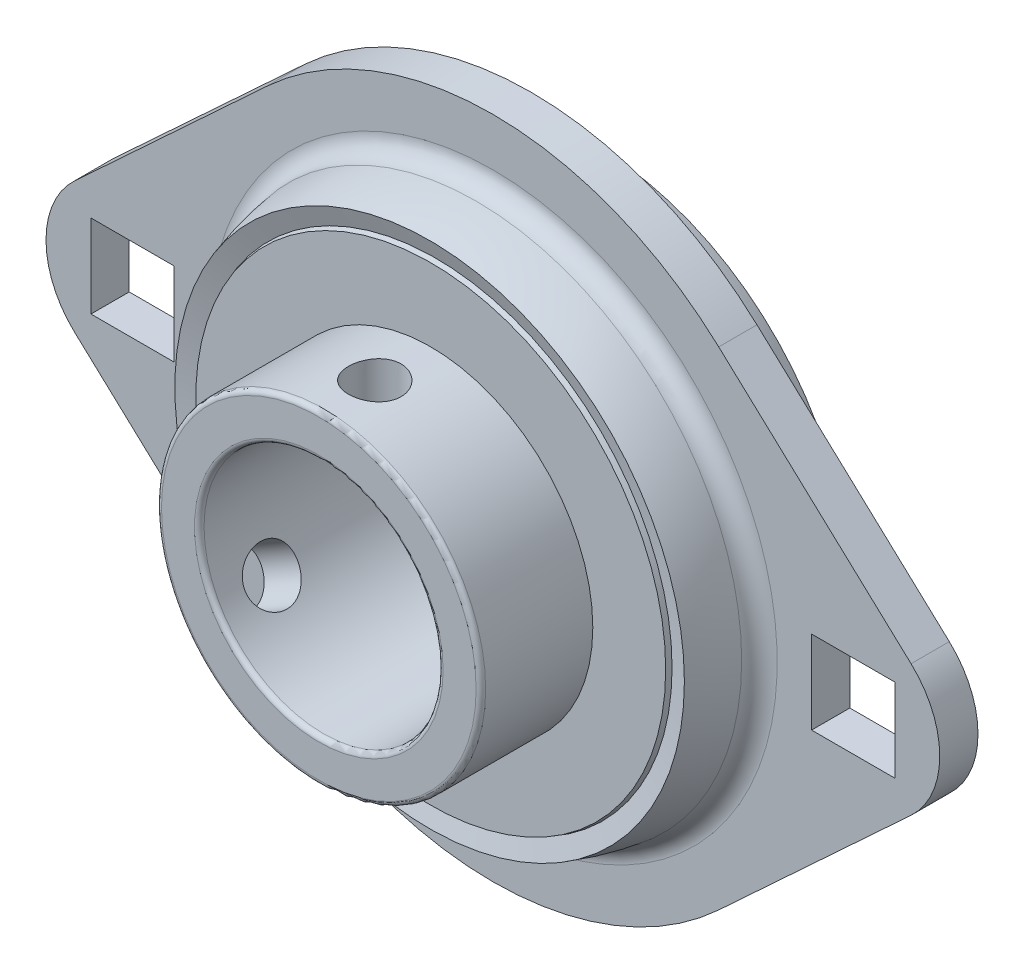
from build123d import *

# Parameters (mm, degrees)
SKETCH_2_W                   = 16.95
SKETCH_2_H                   = 5.5
SKETCH_3_W                   = 16.95
SKETCH_3_H                   = 11.7
HOLE_WIZARD_25_0_25_1_D      = 25
HOLE_WIZARD_5_5_5_5_1_REACH  = 62.391
HOLE_WIZARD_5_5_5_5_1_BORE_R = 2.75
HOLE_WIZARD_5_5_5_5_2_REACH  = 59.658
HOLE_WIZARD_5_5_5_5_2_BORE_R = 2.75
FILLET_1_R                   = 0.5
COMBINE_START                = -10.5
COMBINE_1_2_OUTLINE_W        = 8.7
COMBINE_1_2_OUTLINE_H        = 8.7
COMBINE_1_2_OUTLINE_R        = 29.732137495
COMBINE_1_2_DEPTH            = 4


with BuildPart() as part:
    # Эскиз1 → Повернуть1 (revolve)
    with BuildSketch(Plane(origin=(0, 0, 0), x_dir=(1, 0, 0), z_dir=(0, 1, 0))):
        with BuildLine():
            Line((24.571324751, 17), (0, 17))
            Line((0, 17), (0, 0))
            Line((0, 0), (24.571324751, 0))
            ThreePointArc((24.571324751, 0), (26, 8.5), (24.571324751, 17))
        make_face()
    revolve(axis=Axis((0, 0, -17), (0, 0, 1)))

    # Эскиз2 → Повернуть2 (revolve)
    with BuildSketch(Plane(origin=(0, 0, 0), x_dir=(1, 0, 0), z_dir=(0, 1, 0))):
        with Locations((8.475, 19.75)):
            Rectangle(SKETCH_2_W, SKETCH_2_H)
    revolve(axis=Axis((0, 0, -22.5), (0, 0, 1)))

    # Эскиз3 → Повернуть3 (revolve)
    with BuildSketch(Plane(origin=(0, 0, 0), x_dir=(1, 0, 0), z_dir=(0, 1, 0))):
        with Locations((8.475, -5.85)):
            Rectangle(SKETCH_3_W, SKETCH_3_H)
    revolve(axis=Axis((0, 0, 0), (0, 0, 1)))

    # Диаметр отверстия Ø25.0 (25)1 (through all)
    with Locations(Plane(origin=(0, 0, -22.5), x_dir=(-1, 0, 0), z_dir=(0, 0, -1))):
        with Locations((0, 0)):
            Hole(HOLE_WIZARD_25_0_25_1_D / 2)

    # Диаметр отверстия Ø5.5 (5.5)1 bore (on position points) → Диаметр отверстия Ø5.5 (5.5)1 (cut, up to next)
    with BuildSketch(Plane(origin=(-14.679130594, -8.475, 5.85), x_dir=(0.5, -0.866025403784, 0), z_dir=(-0.866025403784, -0.5, 0)), mode=Mode.PRIVATE) as hole_wizard_5_5_5_5_1_sk1:
        Circle(HOLE_WIZARD_5_5_5_5_1_BORE_R)
    hole_wizard_5_5_5_5_1_tool1 = extrude(hole_wizard_5_5_5_5_1_sk1.sketch, amount=-HOLE_WIZARD_5_5_5_5_1_REACH, mode=Mode.PRIVATE) & part.part
    add(hole_wizard_5_5_5_5_1_tool1.solids().sort_by_distance((-14.679131, -8.475, 5.85))[0], mode=Mode.SUBTRACT)

    # Диаметр отверстия Ø5.5 (5.5)2 bore (on position points) → Диаметр отверстия Ø5.5 (5.5)2 (cut, up to next)
    with BuildSketch(Plane(origin=(0, 16.95, 5.85), x_dir=(1, 0, 0), z_dir=(0, 1, 0)), mode=Mode.PRIVATE) as hole_wizard_5_5_5_5_2_sk1:
        Circle(HOLE_WIZARD_5_5_5_5_2_BORE_R)
    hole_wizard_5_5_5_5_2_tool1 = extrude(hole_wizard_5_5_5_5_2_sk1.sketch, amount=-HOLE_WIZARD_5_5_5_5_2_REACH, mode=Mode.PRIVATE) & part.part
    add(hole_wizard_5_5_5_5_2_tool1.solids().sort_by_distance((0, 16.95, 5.85))[0], mode=Mode.SUBTRACT)

    # Скругление1
    fillet_1_edges = [part.edges().sort_by_distance(p)[0] for p in [
        (-16.95, 0, 11.7),
        (-12.5, 0, -22.5),
        (-12.5, 0, 11.7),
        (-16.95, 0, -22.5),
    ]]
    fillet(fillet_1_edges, radius=FILLET_1_R)

    # Combine 1: read off the stored shape, not the designer's step
    # Combine 1 outline → Combine 1 (revolve)
    with BuildSketch(Plane.XZ):
        with BuildLine():
            ThreePointArc((29.732137495, -8.5), (27.09901514, -9.488909389), (25.767852495, -11.966666667))
            Line((25.767852495, -11.966666667), (24.738633754, -11.966666667))
            Line((24.738633754, -11.966666667), (24.738633754, -16.5))
            Line((24.738633754, -16.5), (26.641605576, -17.115384628))
            ThreePointArc((26.641605576, -17.115384628), (27.305130644, -14.699180633), (27.749994997, -12.23333332))
            ThreePointArc((27.749994997, -12.23333332), (28.415576323, -10.99445469), (29.732137495, -10.5))
            Line((29.732137495, -10.5), (29.732137495, -8.5))
        make_face()
        with BuildLine():
            ThreePointArc((25.767852495, -5.033333333), (27.09901514, -7.511090611), (29.732137495, -8.5))
            Line((29.732137495, -8.5), (29.732137495, -6.5))
            ThreePointArc((29.732137495, -6.5), (28.415576323, -6.00554531), (27.749994997, -4.766666681))
            ThreePointArc((27.749994997, -4.766666681), (27.305130644, -2.300819367), (26.641605576, 0.115384628))
            Line((26.641605576, 0.115384628), (24.738633754, -0.5))
            Line((24.738633754, -0.5), (24.738633754, -5.033333333))
            Line((24.738633754, -5.033333333), (25.767852495, -5.033333333))
        make_face()
    revolve(axis=Axis((0, 0, 0), (0, 0, 1)))

    # Combine 1 2 outline → Combine 1 2 (add)
    with BuildSketch(Plane.XY.offset(COMBINE_START)):
        with BuildLine():
            Line((-43.727741416, -6.862048778), (-23.614933424, -25.493085717))
            ThreePointArc((-23.614933424, -25.493085717), (0, -34.75), (23.614933424, -25.493085717))
            Line((23.614933424, -25.493085717), (43.727741416, -6.862048778))
            ThreePointArc((43.727741416, -6.862048778), (46.725, 0), (43.727741416, 6.862048778))
            Line((43.727741416, 6.862048778), (23.614933424, 25.493085717))
            ThreePointArc((23.614933424, 25.493085717), (0, 34.75), (-23.614933424, 25.493085717))
            Line((-23.614933424, 25.493085717), (-43.727741416, 6.862048778))
            ThreePointArc((-43.727741416, 6.862048778), (-46.725, 0), (-43.727741416, -6.862048778))
        make_face()
        with Locations((-37.675, 0)):
            Rectangle(COMBINE_1_2_OUTLINE_W, COMBINE_1_2_OUTLINE_H, mode=Mode.SUBTRACT)
        Circle(COMBINE_1_2_OUTLINE_R, mode=Mode.SUBTRACT)
        with Locations((37.675, 0)):
            Rectangle(COMBINE_1_2_OUTLINE_W, COMBINE_1_2_OUTLINE_H, mode=Mode.SUBTRACT)
    extrude(amount=COMBINE_1_2_DEPTH)


solid = part.part
